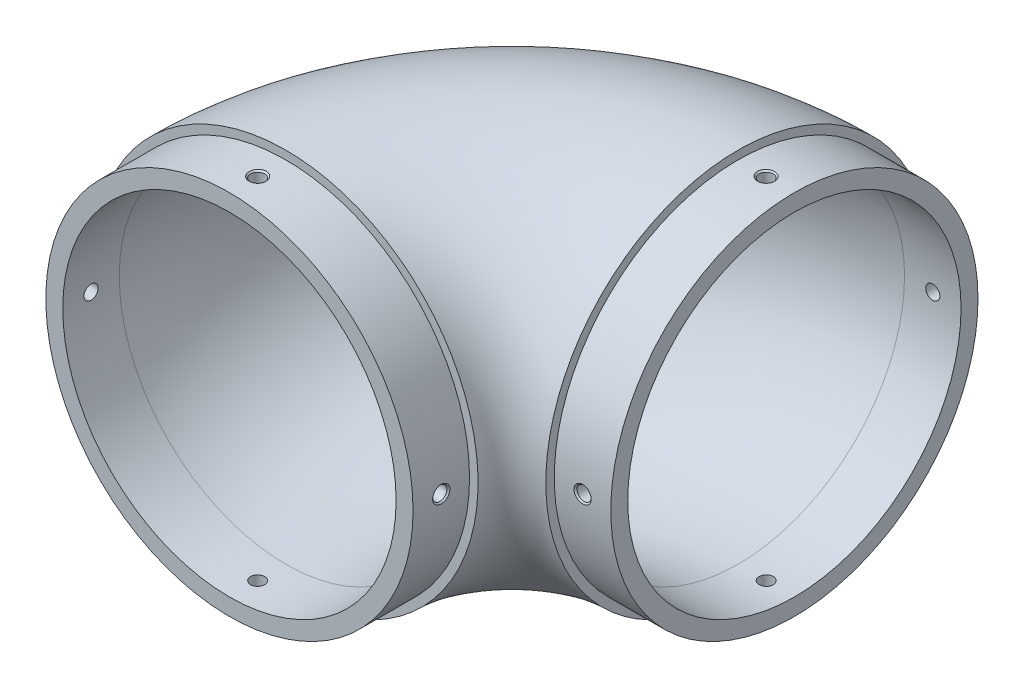
from build123d import *

# Parameters (mm, degrees)
SKETCH_2_R               = 34
SKETCH_2_R_2             = 29.5
CUT_EXTRUDE_START        = -10
SKETCH_22_R              = 34
SKETCH_22_R_2            = 32.5
CUT_EXTRUDE_1_DEPTH      = 10
SKETCH_23_R              = 34
SKETCH_23_R_2            = 32.5
CUT_EXTRUDE_2_DEPTH      = 10
PATTERN_CIRCULAR_1_COUNT = 4
PATTERN_CIRCULAR_2_COUNT = 4


# Read off the part's stored shape, not the designer's step: M3 螺纹孔1, M3 螺纹孔2
with BuildPart() as part:
    # 扫描9: sweep along a path in 草图1
    with BuildLine(Plane(origin=(0, 0, 0), x_dir=(1, 0, 0), z_dir=(0, 1, 0))) as sweep_9_path:
        Line((0, 0), (0, 10))
        ThreePointArc((0, 10), (11.715728753, 38.284271247), (40, 50))
        Line((40, 50), (50, 50))
    # 草图2 → 扫描9 (sweep)
    with BuildSketch(Plane.XY):
        Circle(SKETCH_2_R)
        Circle(SKETCH_2_R_2, mode=Mode.SUBTRACT)
    sweep(path=sweep_9_path.line)

    # 草图22 → 切除-拉伸1 (cut)
    with BuildSketch(Plane.XY.offset(CUT_EXTRUDE_START)):
        Circle(SKETCH_22_R)
        Circle(SKETCH_22_R_2, mode=Mode.SUBTRACT)
    extrude(amount=CUT_EXTRUDE_1_DEPTH, mode=Mode.SUBTRACT)

    # 草图23 → 切除-拉伸2 (cut)
    with BuildSketch(Plane(origin=(50, 0, 0), x_dir=(0, 0, -1), z_dir=(1, 0, 0))):
        with Locations((50, 0)):
            Circle(SKETCH_23_R)
        with Locations((50, 0)):
            Circle(SKETCH_23_R_2, mode=Mode.SUBTRACT)
    extrude(amount=-CUT_EXTRUDE_2_DEPTH, mode=Mode.SUBTRACT)

    # M3 螺纹孔1 outline → M3 螺纹孔1 (revolve, cut)
    with BuildSketch(Plane.YX.offset(5)):
        Polygon((1.25, -32.225), (1.25, -29.473493712), (0, -29.473493712), (0, -32.500009009), (1.525009009, -32.500009009), align=None)
    hole_wizard_m3_1 = revolve(axis=Axis((0, 0, -5), (1, 0, 0)), mode=Mode.SUBTRACT)

    # 阵列(圆周)1: M3 螺纹孔1 ×4 about axis
    pattern_circular_1_axis = Axis((0, 0, -10), (0, 0, 1))
    for i in range(1, PATTERN_CIRCULAR_1_COUNT):
        add(hole_wizard_m3_1.rotate(pattern_circular_1_axis, i * 360 / PATTERN_CIRCULAR_1_COUNT), mode=Mode.SUBTRACT)

    # M3 螺纹孔2 outline → M3 螺纹孔2 (revolve, cut)
    with BuildSketch(Plane(origin=(45, 0, 0), x_dir=(1, 0, 0), z_dir=(0, -1, 0))):
        Polygon((0, -20.526498623), (1.25, -20.526498623), (1.25, -17.775), (1.525009009, -17.499990991), (0, -17.499990991), align=None)
    hole_wizard_m3_2 = revolve(axis=Axis((45, 0, 0), (0, 0, 1)), mode=Mode.SUBTRACT)

    # 阵列(圆周)2: M3 螺纹孔2 ×4 about axis
    pattern_circular_2_axis = Axis((40, 0, -50), (1, 0, 0))
    for i in range(1, PATTERN_CIRCULAR_2_COUNT):
        add(hole_wizard_m3_2.rotate(pattern_circular_2_axis, i * 360 / PATTERN_CIRCULAR_2_COUNT), mode=Mode.SUBTRACT)


solid = part.part
